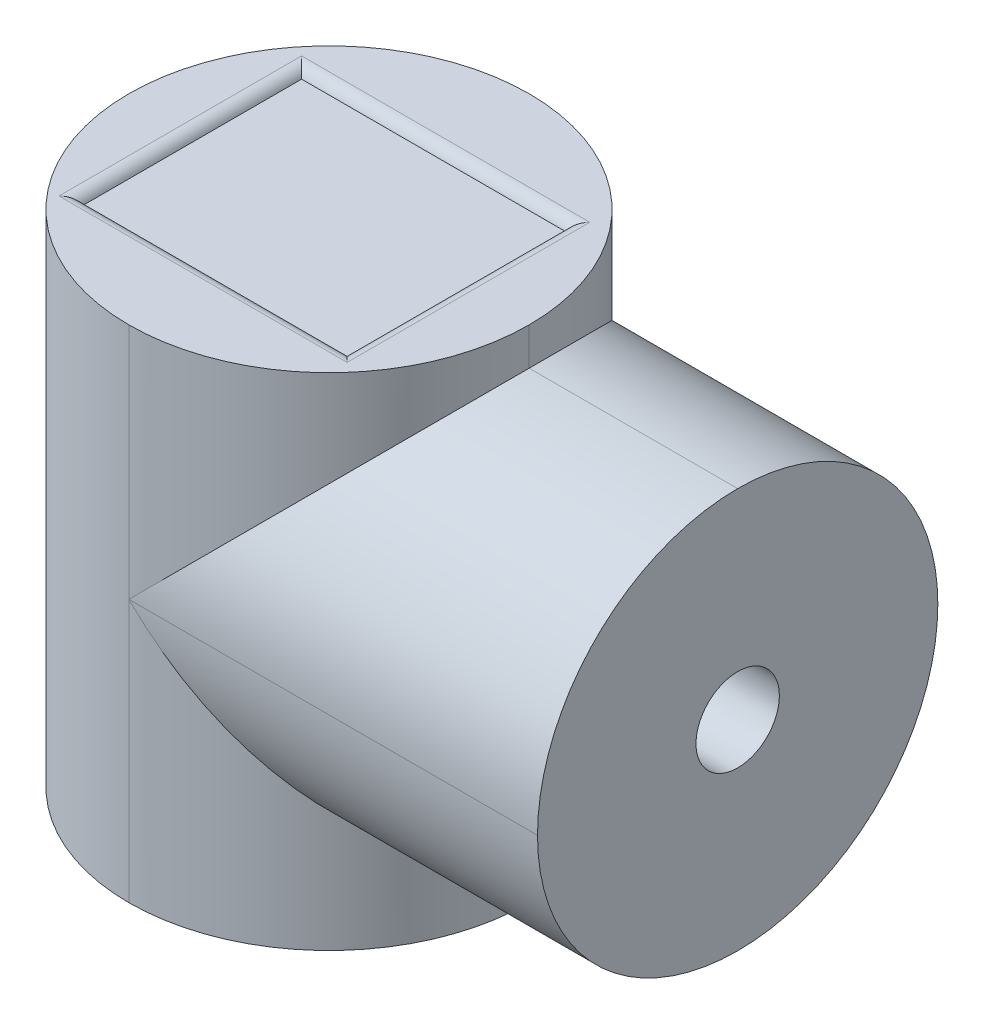
from build123d import *

# Parameters (mm, degrees)
SKETCH1_W           = 48
SKETCH1_H           = 48
BOSS_EXTRUDE1_DEPTH = 60
SKETCH2_W           = 48
SKETCH2_H           = 48
BOSS_EXTRUDE2_DEPTH = 25
FILLET1_R           = 24
SKETCH3_R           = 5
BOSS_EXTRUDE3_DEPTH = 10
SKETCH4_R           = 5
CUT_EXTRUDE1_DEPTH  = 15
SKETCH5_W           = 31.72674495
SKETCH5_H           = 26.264357258
CUT_EXTRUDE2_DEPTH  = 2
SKETCH8_W           = 31.72674495
SKETCH8_H           = 26.264357258
BOSS_EXTRUDE6_DEPTH = 1
FILLET3_R           = 1.5


# Some blends are built 0.0001 mm under size
with BuildPart() as part:
    # Sketch1 → Boss-Extrude1 (new body)
    with BuildSketch(Plane(origin=(0, 0, 0), x_dir=(1, 0, 0), z_dir=(0, 1, 0))):
        with Locations((24, 24)):
            Rectangle(SKETCH1_W, SKETCH1_H)
    extrude(amount=BOSS_EXTRUDE1_DEPTH)

    # Sketch2 → Boss-Extrude2 (add)
    with BuildSketch(Plane(origin=(48, 0, 0), x_dir=(0, 0, -1), z_dir=(1, 0, 0))):
        with Locations((24, 31.5)):
            Rectangle(SKETCH2_W, SKETCH2_H)
    extrude(amount=BOSS_EXTRUDE2_DEPTH)

    # Fillet1
    fillet1_edges = [part.edges().sort_by_distance(p)[0] for p in [
        (0, 30, 0),
        (0, 30, -48),
        (48, 57.75, -48),
        (48, 57.75, 0),
        (48, 3.75, -48),
        (48, 3.75, 0),
        (60.5, 7.5, 0),
        (60.5, 55.5, 0),
        (60.5, 7.5, -48),
        (60.5, 55.5, -48),
    ]]
    fillet(fillet1_edges, radius=FILLET1_R - 0.0001)  # a hair under: the kernel refuses the full size

    # Sketch3 → Boss-Extrude3 (add)
    with BuildSketch(Plane(origin=(0, 0, 0), x_dir=(-1, 0, 0), z_dir=(0, -1, 0))):
        with Locations(Location((-24, 24, 0), (0, 0, 90))):
            Circle(SKETCH3_R)
    extrude(amount=BOSS_EXTRUDE3_DEPTH)

    # Sketch4 → Cut-Extrude1 (cut)
    with BuildSketch(Plane(origin=(73, 0, 0), x_dir=(0, 0, -1), z_dir=(1, 0, 0))):
        with Locations((24, 31.5)):
            Circle(SKETCH4_R)
    extrude(amount=-CUT_EXTRUDE1_DEPTH, mode=Mode.SUBTRACT)

    # Sketch5 → Cut-Extrude2 (cut)
    with BuildSketch(Plane(origin=(0, 60, 0), x_dir=(1, 0, 0), z_dir=(0, 1, 0))):
        with Locations((23.7045439, 23.7381047)):
            Rectangle(SKETCH5_W, SKETCH5_H)
    extrude(amount=-CUT_EXTRUDE2_DEPTH, mode=Mode.SUBTRACT)

    # Sketch8 → Boss-Extrude6 (add)
    with BuildSketch(Plane(origin=(0, 58, 0), x_dir=(1, 0, 0), z_dir=(0, 1, 0))):
        with Locations((23.7045439, 23.7381047)):
            Rectangle(SKETCH8_W, SKETCH8_H)
    extrude(amount=BOSS_EXTRUDE6_DEPTH)

    # Fillet3
    # the kernel refuses this fillet: 1.5 mm, written as the material it takes off along each edge
    with BuildSketch(Plane(origin=(39.567916375, 60, -10.605926071), x_dir=(0, 0, 1), z_dir=(-1, 0, 0)), Plane(origin=(7.841171425, 60, -36.870283329), x_dir=(0, 0, -1), z_dir=(1, 0, 0))) as fillet3_piece_1:
        with BuildLine():
            CenterArc((1.414213562, -1.5), FILLET3_R, 90, 70.528779366)
            Line((0, -1), (-0.028284271, -0.99))
            ThreePointArc((-0.028284271, -0.99), (-0.03, -0.5), (-0.03, 0))
            Line((-0.03, 0), (0, 0.03))
            Line((0, 0.03), (1.414213562, 0.03))
            Line((1.414213562, 0.03), (1.414213562, 0))
        make_face()
    extrude(amount=31.72674495, mode=Mode.SUBTRACT)
    with BuildSketch(Plane(origin=(39.567916375, 60, -36.870283329), x_dir=(1, 0, 0), z_dir=(0, 0, 1)), Plane(origin=(7.841171425, 60, -10.605926071), x_dir=(-1, 0, 0), z_dir=(0, 0, -1))) as fillet3_piece_2:
        with BuildLine():
            CenterArc((1.414213562, -1.5), FILLET3_R, 90, 70.528779366)
            Line((0, -1), (-0.028284271, -0.99))
            ThreePointArc((-0.028284271, -0.99), (-0.03, -0.5), (-0.03, 0))
            Line((-0.03, 0), (0, 0.03))
            Line((0, 0.03), (1.414213562, 0.03))
            Line((1.414213562, 0.03), (1.414213562, 0))
        make_face()
    extrude(amount=26.264357258, mode=Mode.SUBTRACT)
    with BuildSketch(Plane(origin=(43.103450281, 60, -10.605926071), x_dir=(0, 0, 1), z_dir=(-1, 0, 0))) as fillet3_piece_3a_section:
        with BuildLine():
            CenterArc((1.414213562, -1.5), FILLET3_R, 90, 70.528779366)
            Line((0, -1), (-0.028284271, -0.99))
            ThreePointArc((-0.028284271, -0.99), (-0.03, -0.5), (-0.03, 0))
            Line((-0.03, 0), (0, 0.03))
            Line((0, 0.03), (1.414213562, 0.03))
            Line((1.414213562, 0.03), (1.414213562, 0))
        make_face()
    fillet3_piece_3a = extrude(amount=35.262278856, mode=Mode.PRIVATE)
    fillet3_piece_3a = split(fillet3_piece_3a, bisect_by=Plane(origin=(39.567916375, 59.743234105, -10.266766855), z_dir=(1, 0, 0)), keep=Keep.TOP, mode=Mode.PRIVATE)
    with BuildSketch(Plane(origin=(39.567916375, 60, -36.870283329), x_dir=(1, 0, 0), z_dir=(0, 0, 1))) as fillet3_piece_3b_section:
        with BuildLine():
            CenterArc((1.414213562, -1.5), FILLET3_R, 90, 70.528779366)
            Line((0, -1), (-0.028284271, -0.99))
            ThreePointArc((-0.028284271, -0.99), (-0.03, -0.5), (-0.03, 0))
            Line((-0.03, 0), (0, 0.03))
            Line((0, 0.03), (1.414213562, 0.03))
            Line((1.414213562, 0.03), (1.414213562, 0))
        make_face()
    fillet3_piece_3b = extrude(amount=29.799891164, mode=Mode.PRIVATE)
    fillet3_piece_3b = split(fillet3_piece_3b, bisect_by=Plane(origin=(39.90707559, 59.743234105, -10.605926071), z_dir=(0, 0, 1)), keep=Keep.TOP, mode=Mode.PRIVATE)
    fillet3_piece_3 = fillet3_piece_3a & fillet3_piece_3b
    add(fillet3_piece_3, mode=Mode.SUBTRACT)
    with BuildSketch(Plane(origin=(7.841171425, 60, -7.070392165), x_dir=(-1, 0, 0), z_dir=(0, 0, -1))) as fillet3_piece_4a_section:
        with BuildLine():
            CenterArc((1.414213562, -1.5), FILLET3_R, 90, 70.528779366)
            Line((0, -1), (-0.028284271, -0.99))
            ThreePointArc((-0.028284271, -0.99), (-0.03, -0.5), (-0.03, 0))
            Line((-0.03, 0), (0, 0.03))
            Line((0, 0.03), (1.414213562, 0.03))
            Line((1.414213562, 0.03), (1.414213562, 0))
        make_face()
    fillet3_piece_4a = extrude(amount=29.799891164, mode=Mode.PRIVATE)
    fillet3_piece_4a = split(fillet3_piece_4a, bisect_by=Plane(origin=(7.50201221, 59.743234105, -10.605926071), z_dir=(0, 0, 1)), keep=Keep.TOP, mode=Mode.PRIVATE)
    with BuildSketch(Plane(origin=(39.567916375, 60, -10.605926071), x_dir=(0, 0, 1), z_dir=(-1, 0, 0))) as fillet3_piece_4b_section:
        with BuildLine():
            CenterArc((1.414213562, -1.5), FILLET3_R, 90, 70.528779366)
            Line((0, -1), (-0.028284271, -0.99))
            ThreePointArc((-0.028284271, -0.99), (-0.03, -0.5), (-0.03, 0))
            Line((-0.03, 0), (0, 0.03))
            Line((0, 0.03), (1.414213562, 0.03))
            Line((1.414213562, 0.03), (1.414213562, 0))
        make_face()
    fillet3_piece_4b = extrude(amount=35.262278856, mode=Mode.PRIVATE)
    fillet3_piece_4b = split(fillet3_piece_4b, bisect_by=Plane(origin=(7.841171425, 59.743234105, -10.266766855), z_dir=(-1, 0, 0)), keep=Keep.TOP, mode=Mode.PRIVATE)
    fillet3_piece_4 = fillet3_piece_4a & fillet3_piece_4b
    add(fillet3_piece_4, mode=Mode.SUBTRACT)
    with BuildSketch(Plane(origin=(39.567916375, 60, -40.405817235), x_dir=(1, 0, 0), z_dir=(0, 0, 1))) as fillet3_piece_5a_section:
        with BuildLine():
            CenterArc((1.414213562, -1.5), FILLET3_R, 90, 70.528779366)
            Line((0, -1), (-0.028284271, -0.99))
            ThreePointArc((-0.028284271, -0.99), (-0.03, -0.5), (-0.03, 0))
            Line((-0.03, 0), (0, 0.03))
            Line((0, 0.03), (1.414213562, 0.03))
            Line((1.414213562, 0.03), (1.414213562, 0))
        make_face()
    fillet3_piece_5a = extrude(amount=29.799891164, mode=Mode.PRIVATE)
    fillet3_piece_5a = split(fillet3_piece_5a, bisect_by=Plane(origin=(39.90707559, 59.743234105, -36.870283329), z_dir=(0, 0, -1)), keep=Keep.TOP, mode=Mode.PRIVATE)
    with BuildSketch(Plane(origin=(7.841171425, 60, -36.870283329), x_dir=(0, 0, -1), z_dir=(1, 0, 0))) as fillet3_piece_5b_section:
        with BuildLine():
            CenterArc((1.414213562, -1.5), FILLET3_R, 90, 70.528779366)
            Line((0, -1), (-0.028284271, -0.99))
            ThreePointArc((-0.028284271, -0.99), (-0.03, -0.5), (-0.03, 0))
            Line((-0.03, 0), (0, 0.03))
            Line((0, 0.03), (1.414213562, 0.03))
            Line((1.414213562, 0.03), (1.414213562, 0))
        make_face()
    fillet3_piece_5b = extrude(amount=35.262278856, mode=Mode.PRIVATE)
    fillet3_piece_5b = split(fillet3_piece_5b, bisect_by=Plane(origin=(39.567916375, 59.743234105, -37.209442544), z_dir=(1, 0, 0)), keep=Keep.TOP, mode=Mode.PRIVATE)
    fillet3_piece_5 = fillet3_piece_5a & fillet3_piece_5b
    add(fillet3_piece_5, mode=Mode.SUBTRACT)
    with BuildSketch(Plane(origin=(7.841171425, 60, -10.605926071), x_dir=(-1, 0, 0), z_dir=(0, 0, -1))) as fillet3_piece_6a_section:
        with BuildLine():
            CenterArc((1.414213562, -1.5), FILLET3_R, 90, 70.528779366)
            Line((0, -1), (-0.028284271, -0.99))
            ThreePointArc((-0.028284271, -0.99), (-0.03, -0.5), (-0.03, 0))
            Line((-0.03, 0), (0, 0.03))
            Line((0, 0.03), (1.414213562, 0.03))
            Line((1.414213562, 0.03), (1.414213562, 0))
        make_face()
    fillet3_piece_6a = extrude(amount=29.799891164, mode=Mode.PRIVATE)
    fillet3_piece_6a = split(fillet3_piece_6a, bisect_by=Plane(origin=(7.50201221, 59.743234105, -36.870283329), z_dir=(0, 0, -1)), keep=Keep.TOP, mode=Mode.PRIVATE)
    with BuildSketch(Plane(origin=(4.305637519, 60, -36.870283329), x_dir=(0, 0, -1), z_dir=(1, 0, 0))) as fillet3_piece_6b_section:
        with BuildLine():
            CenterArc((1.414213562, -1.5), FILLET3_R, 90, 70.528779366)
            Line((0, -1), (-0.028284271, -0.99))
            ThreePointArc((-0.028284271, -0.99), (-0.03, -0.5), (-0.03, 0))
            Line((-0.03, 0), (0, 0.03))
            Line((0, 0.03), (1.414213562, 0.03))
            Line((1.414213562, 0.03), (1.414213562, 0))
        make_face()
    fillet3_piece_6b = extrude(amount=35.262278856, mode=Mode.PRIVATE)
    fillet3_piece_6b = split(fillet3_piece_6b, bisect_by=Plane(origin=(7.841171425, 59.743234105, -37.209442544), z_dir=(-1, 0, 0)), keep=Keep.TOP, mode=Mode.PRIVATE)
    fillet3_piece_6 = fillet3_piece_6a & fillet3_piece_6b
    add(fillet3_piece_6, mode=Mode.SUBTRACT)


solid = part.part
